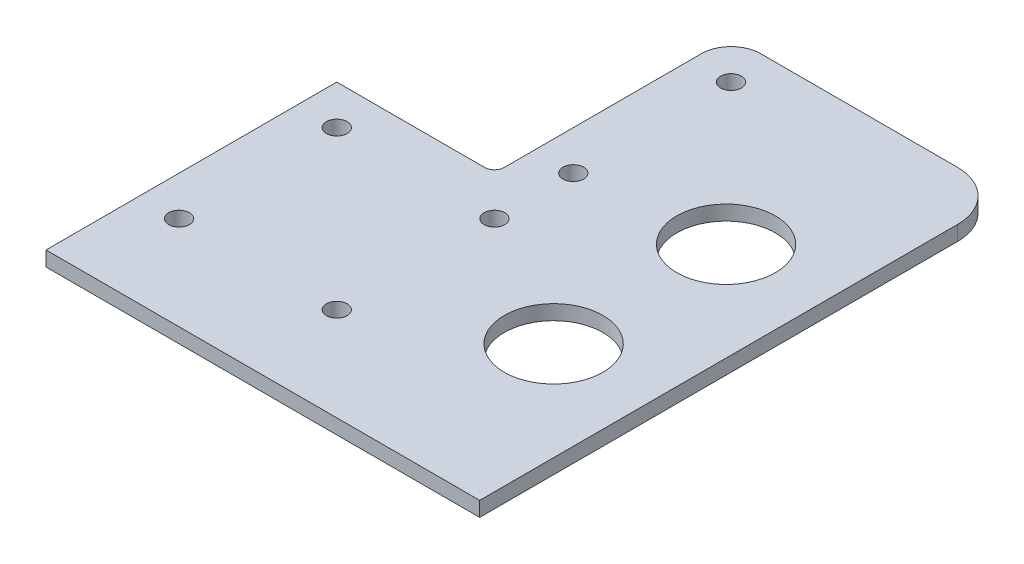
from build123d import *

# Parameters (mm, degrees)
BACKPLATELEFT_MIRRORED_OUTLINE_R   = 2.1
BACKPLATELEFT_MIRRORED_OUTLINE_R_2 = 10
BACKPLATELEFT_MIRRORED_DEPTH       = 3
SKETCH2_W                          = 40
SKETCH2_H                          = 103.465043027
CUT_EXTRUDE1_DEPTH                 = 10
SKETCH3_W                          = 25.884261779
SKETCH3_H                          = 20.988460011
BOSS_EXTRUDE1_DEPTH                = 3
FILLET1_R                          = 10
CUT_EXTRUDE2_DEPTH                 = 97.379458392
CUT_EXTRUDE2_DEPTH_BACK            = 97.379458392
SKETCH4_W                          = 88
SKETCH4_H                          = 4


# Read off the part's stored shape, not the designer's step: backPlateLeft_Mirrored
with BuildPart() as part:
    # backPlateLeft_Mirrored outline → backPlateLeft_Mirrored (new body)
    with BuildSketch(Plane(origin=(0, 0, 0), x_dir=(1, 0, 0), z_dir=(0, 1, 0))):
        with BuildLine():
            Line((-24, 24), (-24, -39))
            Line((-24, -39), (64, -39))
            Line((64, -39), (64, 135))
            ThreePointArc((64, 135), (62.242640687, 139.242640687), (58, 141))
            Line((58, 141), (30, 141))
            ThreePointArc((30, 141), (25.757359313, 139.242640687), (24, 135))
            Line((24, 135), (24, 72))
            Line((24, 72), (14, 72))
            ThreePointArc((14, 72), (9.757359313, 70.242640687), (8, 66))
            Line((8, 66), (8, 26))
            ThreePointArc((8, 26), (7.414213562, 24.585786438), (6, 24))
            Line((6, 24), (-24, 24))
        make_face()
        with Locations((-16, -16)):
            Circle(BACKPLATELEFT_MIRRORED_OUTLINE_R, mode=Mode.SUBTRACT)
        with Locations((16, -16)):
            Circle(BACKPLATELEFT_MIRRORED_OUTLINE_R, mode=Mode.SUBTRACT)
        with Locations((-16, 16)):
            Circle(BACKPLATELEFT_MIRRORED_OUTLINE_R, mode=Mode.SUBTRACT)
        with Locations((16, 16)):
            Circle(BACKPLATELEFT_MIRRORED_OUTLINE_R, mode=Mode.SUBTRACT)
        with Locations((16, 32)):
            Circle(BACKPLATELEFT_MIRRORED_OUTLINE_R, mode=Mode.SUBTRACT)
        with Locations((44, 0)):
            Circle(BACKPLATELEFT_MIRRORED_OUTLINE_R_2, mode=Mode.SUBTRACT)
        with Locations((44, 35)):
            Circle(BACKPLATELEFT_MIRRORED_OUTLINE_R_2, mode=Mode.SUBTRACT)
        with Locations((16, 64)):
            Circle(BACKPLATELEFT_MIRRORED_OUTLINE_R, mode=Mode.SUBTRACT)
        with Locations((44, 70)):
            Circle(BACKPLATELEFT_MIRRORED_OUTLINE_R_2, mode=Mode.SUBTRACT)
        with Locations((44, 105)):
            Circle(BACKPLATELEFT_MIRRORED_OUTLINE_R_2, mode=Mode.SUBTRACT)
    extrude(amount=BACKPLATELEFT_MIRRORED_DEPTH)

    # Sketch2 → Cut-Extrude1 (cut)
    with BuildSketch(Plane(origin=(0, 3, 0), x_dir=(1, 0, 0), z_dir=(0, 1, 0))):
        with Locations((44, 123.732521514)):
            Rectangle(SKETCH2_W, SKETCH2_H)
    extrude(amount=-CUT_EXTRUDE1_DEPTH, mode=Mode.SUBTRACT)

    # Sketch3 → Boss-Extrude1 (add)
    with BuildSketch(Plane(origin=(0, 3, 0), x_dir=(1, 0, 0), z_dir=(0, 1, 0))):
        with Locations((44.305953134, 61.505769994)):
            Rectangle(SKETCH3_W, SKETCH3_H)
    extrude(amount=-BOSS_EXTRUDE1_DEPTH)

    # Fillet1
    fillet1_edges = [part.edges().sort_by_distance(p)[0] for p in [
        (64, 1.5, -72),
    ]]
    fillet(fillet1_edges, radius=FILLET1_R)

    # Sketch4 → Cut-Extrude2 (cut, two sides: drawn at the far end of the back side and taken through both)
    with BuildSketch(Plane(origin=(0, 3, 0), x_dir=(1, 0, 0), z_dir=(0, 1, 0)).offset(-CUT_EXTRUDE2_DEPTH_BACK)):
        with Locations((20, -37)):
            Rectangle(SKETCH4_W, SKETCH4_H)
    extrude(amount=CUT_EXTRUDE2_DEPTH + CUT_EXTRUDE2_DEPTH_BACK, mode=Mode.SUBTRACT)


solid = part.part
